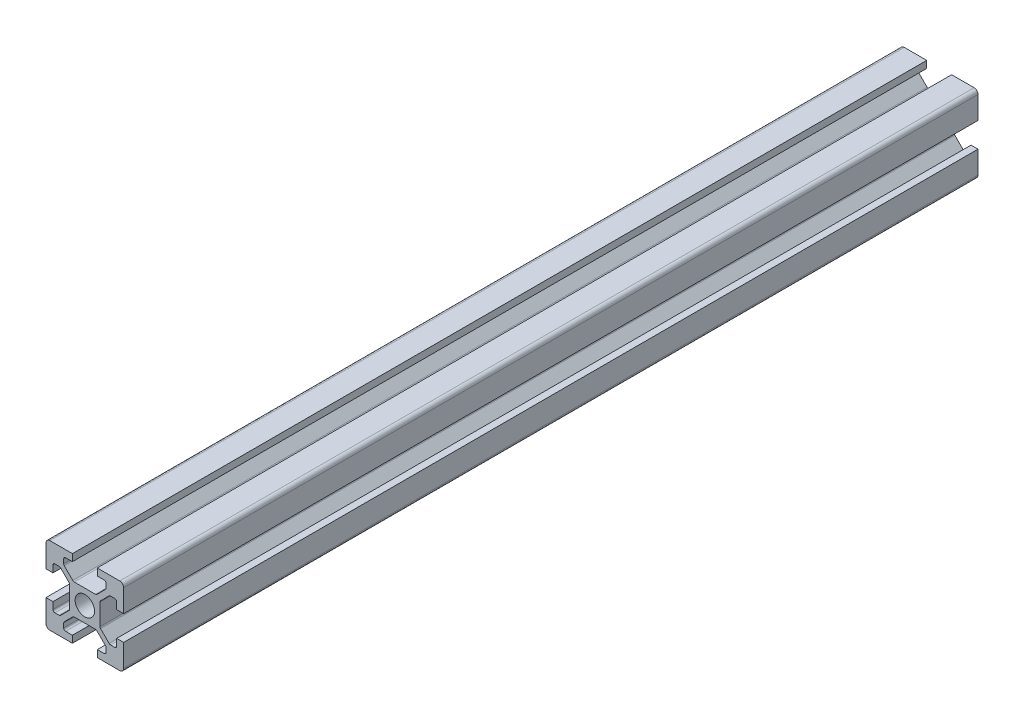
from build123d import *

# Parameters (mm, degrees)
SKETCH1_R           = 2.5
BOSS_EXTRUDE1_DEPTH = 220
FILLET1_R           = 1
FILLET2_R           = 0.5
FILLET3_R           = 0.5
FILLET4_R           = 0.5
FILLET5_R           = 0.5


with BuildPart() as part:
    # Sketch1 → Boss-Extrude1 (new body)
    with BuildSketch(Plane.XY):
        Polygon((0, 6.8), (0, 0), (6.8, 0), (6.8, 1.8), (4.55, 1.8), (4.55, 3.6), (7.05, 6.1), (12.95, 6.1), (15.45, 3.6), (15.45, 1.8), (13.2, 1.8), (13.2, 0), (20, 0), (20, 6.8), (18.2, 6.8), (18.2, 4.55), (16.4, 4.55), (13.9, 7.05), (13.9, 12.95), (16.4, 15.45), (18.2, 15.45), (18.2, 13.2), (20, 13.2), (20, 20), (13.2, 20), (13.2, 18.2), (15.45, 18.2), (15.45, 16.4), (12.95, 13.9), (7.05, 13.9), (4.55, 16.4), (4.55, 18.2), (6.8, 18.2), (6.8, 20), (0, 20), (0, 13.2), (1.8, 13.2), (1.8, 15.45), (3.6, 15.45), (6.1, 12.95), (6.1, 7.05), (3.6, 4.55), (1.8, 4.55), (1.8, 6.8), align=None)
        with Locations((10, 10)):
            Circle(SKETCH1_R, mode=Mode.SUBTRACT)
    extrude(amount=BOSS_EXTRUDE1_DEPTH)

    # Fillet1
    fillet1_edges = [part.edges().sort_by_distance(p)[0] for p in [
        (20, 20, 110),
        (20, 0, 110),
        (0, 0, 110),
        (0, 20, 110),
    ]]
    fillet(fillet1_edges, radius=FILLET1_R)

    # Fillet2
    fillet2_edges = [part.edges().sort_by_distance(p)[0] for p in [
        (4.55, 18.2, 110),
        (4.55, 16.4, 110),
        (7.05, 13.9, 110),
        (15.45, 18.2, 110),
        (15.45, 16.4, 110),
        (12.95, 13.9, 110),
    ]]
    fillet(fillet2_edges, radius=FILLET2_R)

    # Fillet3
    fillet3_edges = [part.edges().sort_by_distance(p)[0] for p in [
        (18.2, 15.45, 110),
        (16.4, 15.45, 110),
        (13.9, 12.95, 110),
        (18.2, 4.55, 110),
        (13.9, 7.05, 110),
        (16.4, 4.55, 110),
    ]]
    fillet(fillet3_edges, radius=FILLET3_R)

    # Fillet4
    fillet4_edges = [part.edges().sort_by_distance(p)[0] for p in [
        (1.8, 15.45, 110),
        (3.6, 15.45, 110),
        (6.1, 12.95, 110),
        (3.6, 4.55, 110),
        (1.8, 4.55, 110),
        (6.1, 7.05, 110),
    ]]
    fillet(fillet4_edges, radius=FILLET4_R)

    # Fillet5
    fillet5_edges = [part.edges().sort_by_distance(p)[0] for p in [
        (7.05, 6.1, 110),
        (4.55, 3.6, 110),
        (4.55, 1.8, 110),
        (15.45, 1.8, 110),
        (15.45, 3.6, 110),
        (12.95, 6.1, 110),
    ]]
    fillet(fillet5_edges, radius=FILLET5_R)


solid = part.part
